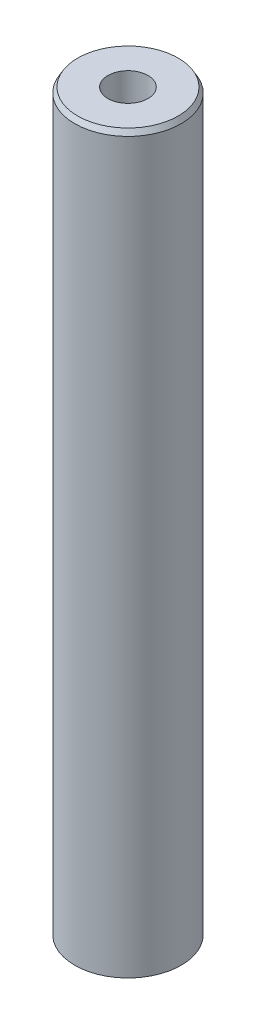
from build123d import *
from OCP.BRepFilletAPI import BRepFilletAPI_MakeChamfer

# Parameters (mm, degrees)
SKETCH1_R           = 7.5
BOSS_EXTRUDE1_DEPTH = 103.863629812
SKETCH2_R           = 2.823955411
CUT_EXTRUDE1_DEPTH  = 105.403800687
CHAMFER1_SIZE       = 0.725682882
CHAMFER1_SIZE2      = 0.418973207


with BuildPart() as part:
    # Sketch1 → Boss-Extrude1 (new body)
    with BuildSketch(Plane(origin=(0, 0, 0), x_dir=(1, 0, 0), z_dir=(0, 1, 0))):
        Circle(SKETCH1_R)
    extrude(amount=BOSS_EXTRUDE1_DEPTH)

    # Sketch2 → Cut-Extrude1 (cut, through all)
    with BuildSketch(Plane(origin=(0, 0, 0), x_dir=(1, 0, 0), z_dir=(0, 1, 0))):
        Circle(SKETCH2_R)
    extrude(amount=CUT_EXTRUDE1_DEPTH, mode=Mode.SUBTRACT)

    # Chamfer1: one chamfer whose edges measure the first distance from different faces: ONE call of the kernel's chamfer builder (chamfer() names one face for all edges)
    chamfer1_edges_1 = [part.edges().sort_by_distance(p)[0] for p in [
        (-7.5, 103.863629812, 0),
    ]]
    chamfer1_side_1 = [part.faces().sort_by_distance(p)[0] for p in [
        (-7.5, 51.931814906, 0),
    ]]
    chamfer1_edges_2 = [part.edges().sort_by_distance(p)[0] for p in [
        (-7.5, 0, 0),
    ]]
    chamfer1_side_2 = [part.faces().sort_by_distance(p)[0] for p in [
        (-7.287867966, 0, 0),
    ]]
    chamfer1 = BRepFilletAPI_MakeChamfer(part.part.solid().wrapped)
    for e in chamfer1_edges_1:
        chamfer1.Add(CHAMFER1_SIZE, CHAMFER1_SIZE2, e.wrapped, chamfer1_side_1[0].wrapped)  # the first distance lies on this face
    for e in chamfer1_edges_2:
        chamfer1.Add(CHAMFER1_SIZE, CHAMFER1_SIZE2, e.wrapped, chamfer1_side_2[0].wrapped)  # the first distance lies on this face
    add(Compound.cast(chamfer1.Shape()), mode=Mode.REPLACE)


solid = part.part
